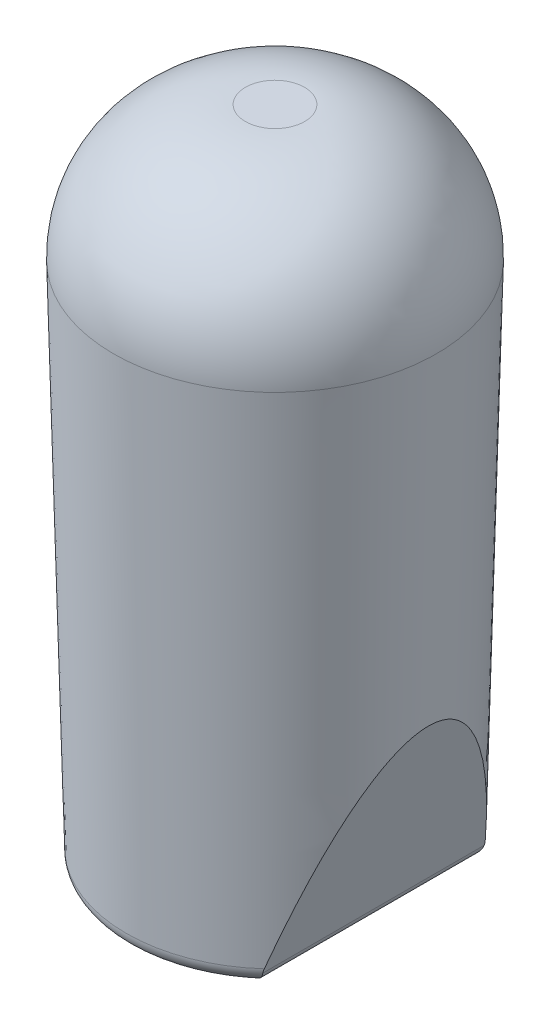
from build123d import *

# Parameters (mm, degrees)
FILETE1_R             = 8
CORTE_EXTRUS_O1_DEPTH = 43.331808746
FILETE2_R             = 1
ESBO_O3_W             = 4.76
ESBO_O3_H             = 14
CORTE_EXTRUS_O2_DEPTH = 25


with BuildPart() as part:
    # Esboço1 → Revolução1 (revolve)
    with BuildSketch(Plane.XY):
        Polygon((0, 0), (0, 40), (10, 40), (9, 0), align=None)
    revolve(axis=Axis((0, 0, 0), (0, 1, 0)))

    # Filete1
    filete1_edges = [part.edges().sort_by_distance(p)[0] for p in [
        (-10, 40, 0),
    ]]
    fillet(filete1_edges, radius=FILETE1_R)

    # Esboço2 → Corte-extrusão1 (cut, symmetric)
    with BuildSketch(Plane.XY):
        Polygon((-36.410692703, 103.924081696), (-9.3, 12), (-5.760902231, 0), (21.349790472, -91.924081696), (-162.498372921, -146.145467103), (-220.258856096, 49.70269629), align=None)
    corte_extrus_o1 = extrude(amount=CORTE_EXTRUS_O1_DEPTH, both=True, mode=Mode.SUBTRACT)

    # Espelhar1: Corte-extrusão1 across plane
    add(corte_extrus_o1.mirror(Plane(origin=(0, 0, 0), x_dir=(0, 0, 1), z_dir=(1, 0, 0))), mode=Mode.SUBTRACT)

    # Filete2
    filete2_edges = [part.edges().sort_by_distance(p)[0] for p in [
        (5.760902231, 0, 0),
        (-5.760902231, 0, 0),
        (0, 0, -9),
        (0, 0, 9),
    ]]
    fillet(filete2_edges, radius=FILETE2_R)

    # Esboço3 → Corte-extrusão2 (cut)
    with BuildSketch(Plane.XZ):
        Rectangle(ESBO_O3_W, ESBO_O3_H)
    extrude(amount=-CORTE_EXTRUS_O2_DEPTH, mode=Mode.SUBTRACT)


solid = part.part
